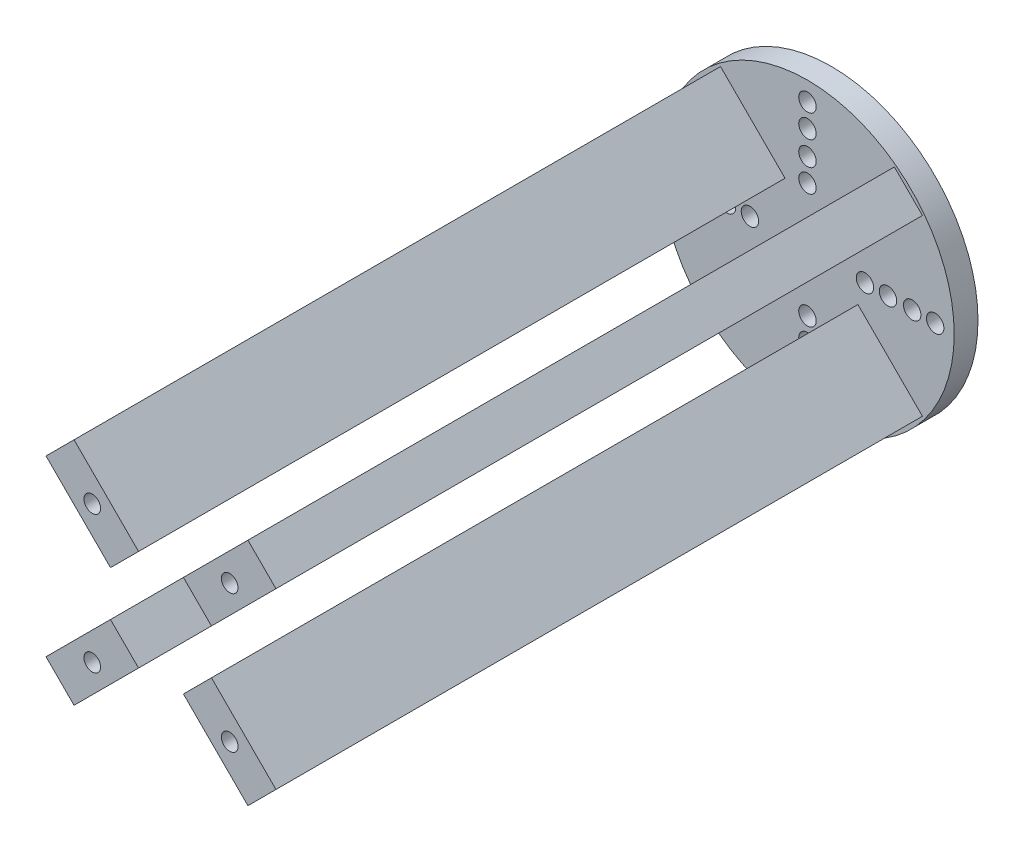
from build123d import *

# Parameters (mm, degrees)
SKIZZE2_R                       = 18.5
SKIZZE2_R_2                     = 1.1
AUFSATZ_LINEAR_AUSTRAGEN1_DEPTH = 3
AUFSATZ_LINEAR_AUSTRAGEN2_DEPTH = 81.5
SKIZZE5_R                       = 1.05
SCHNITT_LINEAR_AUSTRAGEN2_DEPTH = 13


with BuildPart() as part:
    # Skizze2 → Aufsatz-Linear austragen1 (new body)
    with BuildSketch(Plane.XY):
        Circle(SKIZZE2_R)
        with Locations((16.1, 0)):
            Circle(SKIZZE2_R_2, mode=Mode.SUBTRACT)
        with Locations((13.2, 0)):
            Circle(SKIZZE2_R_2, mode=Mode.SUBTRACT)
        with Locations((10.15, 0)):
            Circle(SKIZZE2_R_2, mode=Mode.SUBTRACT)
        with Locations((7.25, 0)):
            Circle(SKIZZE2_R_2, mode=Mode.SUBTRACT)
        with Locations((0, 7.25)):
            Circle(SKIZZE2_R_2, mode=Mode.SUBTRACT)
        with Locations((0, 10.15)):
            Circle(SKIZZE2_R_2, mode=Mode.SUBTRACT)
        with Locations((0, 13.2)):
            Circle(SKIZZE2_R_2, mode=Mode.SUBTRACT)
        with Locations((0, 16.1)):
            Circle(SKIZZE2_R_2, mode=Mode.SUBTRACT)
        with Locations((0, -16.1)):
            Circle(SKIZZE2_R_2, mode=Mode.SUBTRACT)
        with Locations((0, -13.2)):
            Circle(SKIZZE2_R_2, mode=Mode.SUBTRACT)
        with Locations((0, -10.15)):
            Circle(SKIZZE2_R_2, mode=Mode.SUBTRACT)
        with Locations((0, -7.25)):
            Circle(SKIZZE2_R_2, mode=Mode.SUBTRACT)
        with Locations((-16.1, 0)):
            Circle(SKIZZE2_R_2, mode=Mode.SUBTRACT)
        with Locations((-7.25, 0)):
            Circle(SKIZZE2_R_2, mode=Mode.SUBTRACT)
        with Locations((-10.15, 0)):
            Circle(SKIZZE2_R_2, mode=Mode.SUBTRACT)
        with Locations((-13.2, 0)):
            Circle(SKIZZE2_R_2, mode=Mode.SUBTRACT)
    extrude(amount=AUFSATZ_LINEAR_AUSTRAGEN1_DEPTH)

    # Skizze4 → Aufsatz-Linear austragen2 (add)
    with BuildSketch(Plane.XY.offset(3)):
        Polygon((2.828427125, 6.363961031), (10.960155108, 14.495689014), (14.495689014, 10.960155108), (6.363961031, 2.828427125), align=None)
        Polygon((6.363961031, -2.828427125), (14.495689014, -10.960155108), (10.960155108, -14.495689014), (2.828427125, -6.363961031), align=None)
        Polygon((-2.828427125, -6.363961031), (-10.960155108, -14.495689014), (-14.495689014, -10.960155108), (-6.363961031, -2.828427125), align=None)
        Polygon((-6.363961031, 2.828427125), (-14.495689014, 10.960155108), (-10.960155108, 14.495689014), (-2.828427125, 6.363961031), align=None)
    extrude(amount=AUFSATZ_LINEAR_AUSTRAGEN2_DEPTH)

    # Skizze5 → Schnitt-Linear austragen2 (cut)
    with BuildSketch(Plane.XY.offset(84.5)):
        with Locations((-8.66205807, -8.66205807)):
            Circle(SKIZZE5_R)
        with Locations((-8.66205807, 8.66205807)):
            Circle(SKIZZE5_R)
        with Locations((8.66205807, 8.66205807)):
            Circle(SKIZZE5_R)
        with Locations((8.66205807, -8.66205807)):
            Circle(SKIZZE5_R)
    extrude(amount=-SCHNITT_LINEAR_AUSTRAGEN2_DEPTH, mode=Mode.SUBTRACT)


solid = part.part
